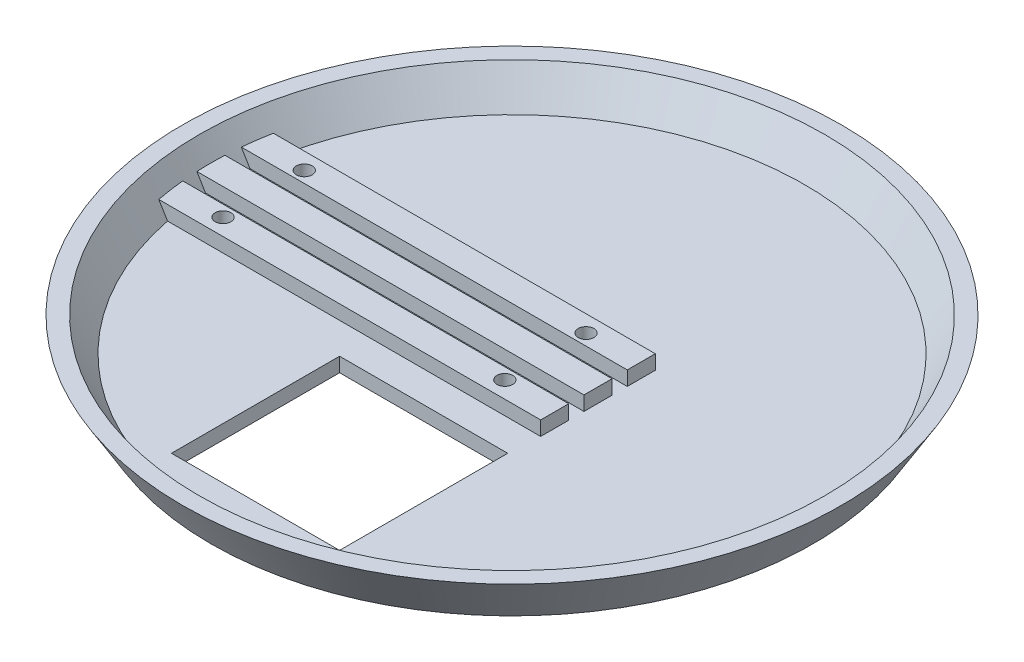
from build123d import *

# Parameters (mm, degrees)
SKETCH2_W                = 35.2
SKETCH2_H                = 35.2
CUT_EXTRUDE1_DEPTH       = 98.831487774
BOSS_EXTRUDE1_DEPTH      = 10
BOSS_EXTRUDE1_DEPTH_BACK = 63.5
SKETCH4_W                = 5.866666667
SKETCH4_H                = 3
SKETCH4_W_2              = 5.866666666
SKETCH5_R                = 1.65
CUT_EXTRUDE2_DEPTH       = 99.091793744
SKETCH8_W                = 5.866666667
SKETCH8_H                = 3
SKETCH8_W_2              = 5.866666666
BOSS_EXTRUDE3_DEPTH      = 8


with BuildPart() as part:
    # Sketch1 → Revolve1 (revolve)
    with BuildSketch(Plane.XY):
        Polygon((0, 0), (63, 0), (69, 10), (65.501428863, 10), (61.301428863, 3), (0, 3), align=None)
    revolve(axis=Axis((0, 0, 0), (0, 1, 0)))

    # Sketch2 → Cut-Extrude1 (cut, through all)
    with BuildSketch(Plane(origin=(0, 3, 0), x_dir=(1, 0, 0), z_dir=(0, 1, 0))):
        with Locations((0, -36.1)):
            Rectangle(SKETCH2_W, SKETCH2_H)
    extrude(amount=-CUT_EXTRUDE1_DEPTH, mode=Mode.SUBTRACT)

    # Sketch4 → Boss-Extrude1 (add, two sides: drawn at the far end of the back side and taken through both)
    with BuildSketch(Plane(origin=(0, 0, 0), x_dir=(0, 0, -1), z_dir=(1, 0, 0)).offset(-BOSS_EXTRUDE1_DEPTH_BACK)):
        with Locations((-9.066666666, 4.5)):
            Rectangle(SKETCH4_W, SKETCH4_H)
        with Locations((0, 4.5)):
            Rectangle(SKETCH4_W_2, SKETCH4_H)
        with Locations((9.066666666, 4.5)):
            Rectangle(SKETCH4_W, SKETCH4_H)
    extrude(amount=BOSS_EXTRUDE1_DEPTH + BOSS_EXTRUDE1_DEPTH_BACK)

    # Sketch5 → Cut-Extrude2 (cut, through all)
    with BuildSketch(Plane(origin=(0, 0, 0), x_dir=(1, 0, 0), z_dir=(0, 1, 0))):
        with Locations((7, -8.5)):
            Circle(SKETCH5_R)
        with Locations((7, 8.5)):
            Circle(SKETCH5_R)
        with Locations((-52, 8.5)):
            Circle(SKETCH5_R)
        with Locations((-52, -8.5)):
            Circle(SKETCH5_R)
    extrude(amount=CUT_EXTRUDE2_DEPTH, mode=Mode.SUBTRACT)

    # Sketch8 → Boss-Extrude3 (add)
    with BuildSketch(Plane(origin=(10, 0, 0), x_dir=(0, 0, -1), z_dir=(1, 0, 0))):
        with Locations((-9.066666666, 4.5)):
            Rectangle(SKETCH8_W, SKETCH8_H)
        with Locations((0, 4.5)):
            Rectangle(SKETCH8_W_2, SKETCH8_H)
        with Locations((9.066666666, 4.5)):
            Rectangle(SKETCH8_W, SKETCH8_H)
    extrude(amount=BOSS_EXTRUDE3_DEPTH)


solid = part.part
